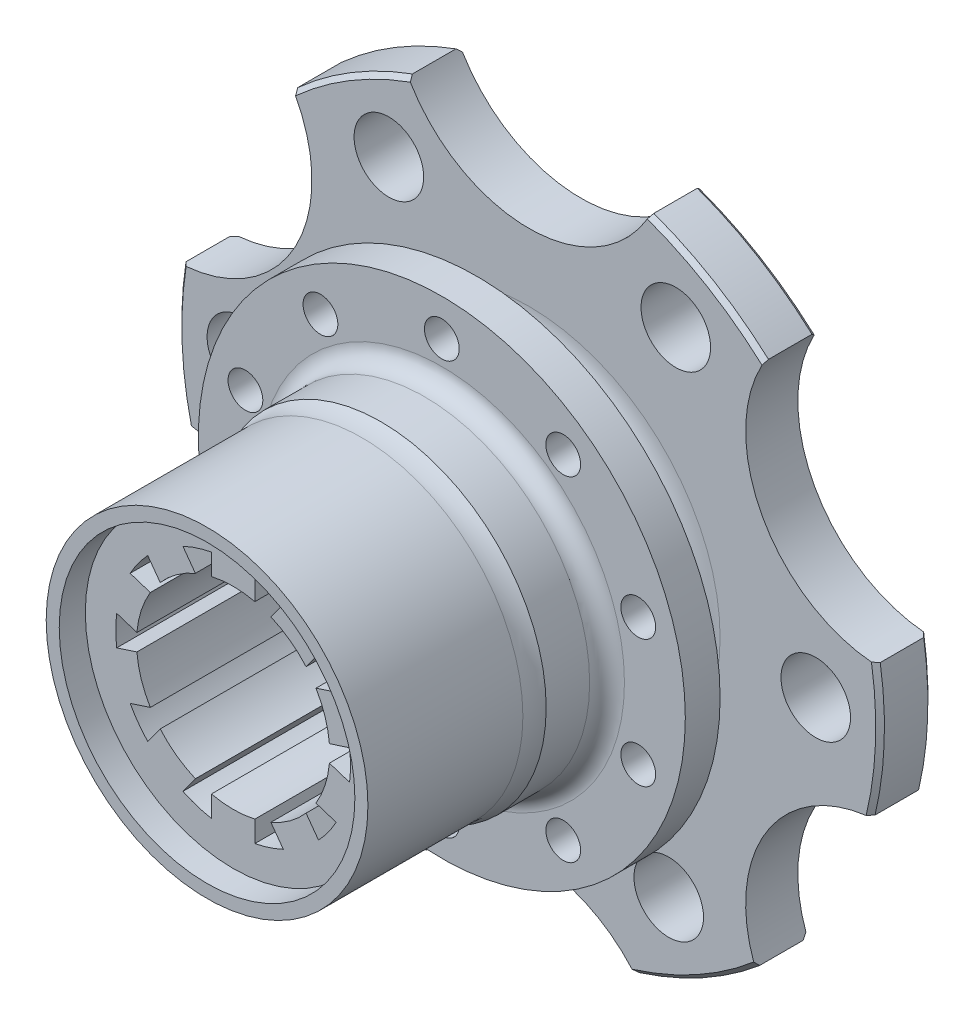
from build123d import *

# Parameters (mm, degrees)
SKETCH1_R               = 40.4
BOSS_EXTRUDE1_DEPTH     = 3
CUT_EXTRUDE1_DEPTH      = 58.2129356
CIRPATTERN1_COUNT       = 6
SKETCH3_R               = 4
CUT_EXTRUDE2_DEPTH      = 57.132541063
SKETCH4_R               = 17
BOSS_EXTRUDE2_DEPTH     = 40
CUT_EXTRUDE3_DEPTH      = 69.664853937
CUT_EXTRUDE3_DEPTH_BACK = 69.664853937
SKETCH5_R               = 11.1125
FILLET1_R               = 5
SKETCH6_R               = 28
SKETCH6_R_2             = 17
BOSS_EXTRUDE3_DEPTH     = 4
SKETCH7_R               = 19
SKETCH7_R_2             = 17
BOSS_EXTRUDE4_DEPTH     = 7
SKETCH8_R               = 18.5
SKETCH8_R_2             = 17
EXTRUDE_THIN1_DEPTH     = 20
CUT_EXTRUDE4_REACH      = 63.999
SKETCH9_R               = 2
FILLET2_R               = 5
FILLET3_R               = 2
CHAMFER1_SIZE           = 0.5
CHAMFER2_SIZE           = 4
CUT_EXTRUDE6_DEPTH      = 69.664854111
CUT_EXTRUDE6_DEPTH_BACK = 69.664854111


with BuildPart() as part:
    # Sketch1 → Boss-Extrude1 (new, symmetric)
    with BuildSketch(Plane.XY):
        Circle(SKETCH1_R)
    extrude(amount=BOSS_EXTRUDE1_DEPTH, both=True)

    # Sketch2 → Cut-Extrude1 (cut, symmetric)
    with BuildSketch(Plane.XY):
        with BuildLine():
            ThreePointArc((0, 61.461961419), (-13.591228185, 53.77241449), (-14, 38.162048666))
            ThreePointArc((-14, 38.162048666), (-8.166433781, 32.014752525), (0, 29.75))
            Line((0, 29.75), (0, 61.461961419))
        make_face()
        with BuildLine():
            ThreePointArc((15.85598071, 45.60598071), (11.211871482, 56.817852192), (0, 61.461961419))
            Line((0, 61.461961419), (0, 29.75))
            ThreePointArc((0, 29.75), (8.166433781, 32.014752525), (14, 38.162048666))
            ThreePointArc((14, 38.162048666), (15.384990318, 41.7700718), (15.85598071, 45.60598071))
        make_face()
        with BuildLine():
            Line((30.296043793, 68.810449508), (0, 68.810449508))
            Line((0, 68.810449508), (0, 61.461961419))
            ThreePointArc((0, 61.461961419), (11.211871482, 56.817852192), (15.85598071, 45.60598071))
            ThreePointArc((15.85598071, 45.60598071), (15.384990318, 41.7700718), (14, 38.162048666))
            Line((14, 38.162048666), (30.296043793, 68.810449508))
        make_face()
        with BuildLine():
            Line((0, 68.810449508), (-30.296043793, 68.810449508))
            Line((-30.296043793, 68.810449508), (-14, 38.162048666))
            ThreePointArc((-14, 38.162048666), (-13.591228185, 53.77241449), (0, 61.461961419))
            Line((0, 61.461961419), (0, 68.810449508))
        make_face()
    cut_extrude1 = extrude(amount=CUT_EXTRUDE1_DEPTH, both=True, mode=Mode.SUBTRACT)

    # CirPattern1: Cut-Extrude1 ×6 about axis
    cirpattern1_axis = Axis((0, -1.498566429, 0), (0, 0, 1))
    for i in range(1, CIRPATTERN1_COUNT):
        add(cut_extrude1.rotate(cirpattern1_axis, i * 360 / CIRPATTERN1_COUNT), mode=Mode.SUBTRACT)

    # Sketch3 → Cut-Extrude2 (cut, through all)
    with BuildSketch(Plane.XY.offset(3)):
        with Locations((16.90518394, 28.341043664)):
            Circle(SKETCH3_R)
        with Locations((32.996655753, -0.469796916)):
            Circle(SKETCH3_R)
        with Locations((16.091471813, -28.81084058)):
            Circle(SKETCH3_R)
        with Locations((-16.90518394, -28.341043664)):
            Circle(SKETCH3_R)
        with Locations((-32.996655753, 0.469796916)):
            Circle(SKETCH3_R)
        with Locations((-16.091471813, 28.81084058)):
            Circle(SKETCH3_R)
    extrude(amount=-CUT_EXTRUDE2_DEPTH, mode=Mode.SUBTRACT)

    # Sketch4 → Boss-Extrude2 (add)
    with BuildSketch(Plane(origin=(0, 0, -3), x_dir=(-1, 0, 0), z_dir=(0, 0, -1))):
        Circle(SKETCH4_R)
    extrude(amount=-BOSS_EXTRUDE2_DEPTH)

    # Sketch5 → Cut-Extrude3 (cut, two sides: drawn at the far end of the back side and taken through both)
    with BuildSketch(Plane.XY.offset(37).offset(-CUT_EXTRUDE3_DEPTH_BACK)):
        Circle(SKETCH5_R)
    extrude(amount=CUT_EXTRUDE3_DEPTH + CUT_EXTRUDE3_DEPTH_BACK, mode=Mode.SUBTRACT)

    # Fillet1
    fillet1_edges = [part.edges().sort_by_distance(p)[0] for p in [
        (17, 0, 3),
    ]]
    fillet(fillet1_edges, radius=FILLET1_R)

    # Sketch6 → Boss-Extrude3 (add)
    with BuildSketch(Plane.XY.offset(9)):
        Circle(SKETCH6_R)
        Circle(SKETCH6_R_2, mode=Mode.SUBTRACT)
    extrude(amount=BOSS_EXTRUDE3_DEPTH)

    # Sketch7 → Boss-Extrude4 (add)
    with BuildSketch(Plane.XY.offset(13)):
        Circle(SKETCH7_R)
        Circle(SKETCH7_R_2, mode=Mode.SUBTRACT)
    extrude(amount=BOSS_EXTRUDE4_DEPTH)

    # Sketch8 → Extrude-Thin1 (add)
    with BuildSketch(Plane.XY.offset(20)):
        Circle(SKETCH8_R)
        Circle(SKETCH8_R_2, mode=Mode.SUBTRACT)
    extrude(amount=EXTRUDE_THIN1_DEPTH)

    # Sketch9 → Cut-Extrude4 (cut, up to next)
    with BuildSketch(Plane.XY.offset(13), mode=Mode.PRIVATE) as cut_extrude4_sk1:
        with Locations((0, 23.75)):
            Circle(SKETCH9_R)
    cut_extrude4_tool1 = extrude(cut_extrude4_sk1.sketch, amount=-CUT_EXTRUDE4_REACH, mode=Mode.PRIVATE) & part.part
    # Sketch9 → Cut-Extrude4 (cut, up to next)
    with BuildSketch(Plane.XY.offset(13), mode=Mode.PRIVATE) as cut_extrude4_sk2:
        with Locations((13.959899742, 19.214153616)):
            Circle(SKETCH9_R)
    cut_extrude4_tool2 = extrude(cut_extrude4_sk2.sketch, amount=-CUT_EXTRUDE4_REACH, mode=Mode.PRIVATE) & part.part
    # Sketch9 → Cut-Extrude4 (cut, up to next)
    with BuildSketch(Plane.XY.offset(13), mode=Mode.PRIVATE) as cut_extrude4_sk3:
        with Locations((22.587592262, 7.339153616)):
            Circle(SKETCH9_R)
    cut_extrude4_tool3 = extrude(cut_extrude4_sk3.sketch, amount=-CUT_EXTRUDE4_REACH, mode=Mode.PRIVATE) & part.part
    # Sketch9 → Cut-Extrude4 (cut, up to next)
    with BuildSketch(Plane.XY.offset(13), mode=Mode.PRIVATE) as cut_extrude4_sk4:
        with Locations((22.587592262, -7.339153616)):
            Circle(SKETCH9_R)
    cut_extrude4_tool4 = extrude(cut_extrude4_sk4.sketch, amount=-CUT_EXTRUDE4_REACH, mode=Mode.PRIVATE) & part.part
    # Sketch9 → Cut-Extrude4 (cut, up to next)
    with BuildSketch(Plane.XY.offset(13), mode=Mode.PRIVATE) as cut_extrude4_sk5:
        with Locations((13.959899742, -19.214153616)):
            Circle(SKETCH9_R)
    cut_extrude4_tool5 = extrude(cut_extrude4_sk5.sketch, amount=-CUT_EXTRUDE4_REACH, mode=Mode.PRIVATE) & part.part
    # Sketch9 → Cut-Extrude4 (cut, up to next)
    with BuildSketch(Plane.XY.offset(13), mode=Mode.PRIVATE) as cut_extrude4_sk6:
        with Locations((0, -23.75)):
            Circle(SKETCH9_R)
    cut_extrude4_tool6 = extrude(cut_extrude4_sk6.sketch, amount=-CUT_EXTRUDE4_REACH, mode=Mode.PRIVATE) & part.part
    # Sketch9 → Cut-Extrude4 (cut, up to next)
    with BuildSketch(Plane.XY.offset(13), mode=Mode.PRIVATE) as cut_extrude4_sk7:
        with Locations((-13.959899742, -19.214153616)):
            Circle(SKETCH9_R)
    cut_extrude4_tool7 = extrude(cut_extrude4_sk7.sketch, amount=-CUT_EXTRUDE4_REACH, mode=Mode.PRIVATE) & part.part
    # Sketch9 → Cut-Extrude4 (cut, up to next)
    with BuildSketch(Plane.XY.offset(13), mode=Mode.PRIVATE) as cut_extrude4_sk8:
        with Locations((-22.587592262, -7.339153616)):
            Circle(SKETCH9_R)
    cut_extrude4_tool8 = extrude(cut_extrude4_sk8.sketch, amount=-CUT_EXTRUDE4_REACH, mode=Mode.PRIVATE) & part.part
    # Sketch9 → Cut-Extrude4 (cut, up to next)
    with BuildSketch(Plane.XY.offset(13), mode=Mode.PRIVATE) as cut_extrude4_sk9:
        with Locations((-22.587592262, 7.339153616)):
            Circle(SKETCH9_R)
    cut_extrude4_tool9 = extrude(cut_extrude4_sk9.sketch, amount=-CUT_EXTRUDE4_REACH, mode=Mode.PRIVATE) & part.part
    # Sketch9 → Cut-Extrude4 (cut, up to next)
    with BuildSketch(Plane.XY.offset(13), mode=Mode.PRIVATE) as cut_extrude4_sk10:
        with Locations((-13.959899742, 19.214153616)):
            Circle(SKETCH9_R)
    cut_extrude4_tool10 = extrude(cut_extrude4_sk10.sketch, amount=-CUT_EXTRUDE4_REACH, mode=Mode.PRIVATE) & part.part
    add(cut_extrude4_tool1.solids().sort_by_distance((0, 23.75, 13))[0], mode=Mode.SUBTRACT)
    add(cut_extrude4_tool2.solids().sort_by_distance((13.9599, 19.214154, 13))[0], mode=Mode.SUBTRACT)
    add(cut_extrude4_tool3.solids().sort_by_distance((22.587592, 7.339154, 13))[0], mode=Mode.SUBTRACT)
    add(cut_extrude4_tool4.solids().sort_by_distance((22.587592, -7.339154, 13))[0], mode=Mode.SUBTRACT)
    add(cut_extrude4_tool5.solids().sort_by_distance((13.9599, -19.214154, 13))[0], mode=Mode.SUBTRACT)
    add(cut_extrude4_tool6.solids().sort_by_distance((0, -23.75, 13))[0], mode=Mode.SUBTRACT)
    add(cut_extrude4_tool7.solids().sort_by_distance((-13.9599, -19.214154, 13))[0], mode=Mode.SUBTRACT)
    add(cut_extrude4_tool8.solids().sort_by_distance((-22.587592, -7.339154, 13))[0], mode=Mode.SUBTRACT)
    add(cut_extrude4_tool9.solids().sort_by_distance((-22.587592, 7.339154, 13))[0], mode=Mode.SUBTRACT)
    add(cut_extrude4_tool10.solids().sort_by_distance((-13.9599, 19.214154, 13))[0], mode=Mode.SUBTRACT)

    # Fillet2
    # the kernel refuses this fillet: 5 mm, written as the material it adds along each edge
    with BuildSketch(Plane(origin=(0, 0, 20), x_dir=(1, 0, 0), z_dir=(0, -1, 0))) as fillet2_piece_1:
        with BuildLine():
            CenterArc((23.5, 2.179449472), FILLET2_R, 180, 25.841932763)
            Line((18.5, 2.179449472), (18.4, 2.179449472))
            Line((18.4, 2.179449472), (18.4, 0))
            Line((18.4, 0), (18.5, -0.1))
            ThreePointArc((18.5, -0.1), (18.75, -0.1), (18.91, -0.043588989))
            Line((18.91, -0.043588989), (19, 0))
        make_face()
    revolve(axis=Axis((0, 0, 20), (0, 0, 1)))

    # Fillet3
    fillet3_edges = [part.edges().sort_by_distance(p)[0] for p in [
        (-19, 0, 13),
    ]]
    fillet(fillet3_edges, radius=FILLET3_R)

    # Chamfer1
    chamfer1_edges = [part.edges().sort_by_distance(p)[0] for p in [
        (-40.370279201, -1.549373164, -3),
        (-19.512965356, -35.375191632, -3),
        (19.512965356, -35.375191632, -3),
        (40.370279201, -1.549373164, -3),
        (20.85615574, 34.600300111, -3),
        (-40.370279201, -1.549373164, 3),
        (-19.512965356, -35.375191632, 3),
        (19.512965356, -35.375191632, 3),
        (40.370279201, -1.549373164, 3),
        (20.85615574, 34.600300111, 3),
        (-20.85615574, 34.600300111, -3),
        (-20.85615574, 34.600300111, 3),
    ]]
    chamfer(chamfer1_edges, length=CHAMFER1_SIZE)

    # Chamfer2
    chamfer2_edges = [part.edges().sort_by_distance(p)[0] for p in [
        (-11.1125, 0, -3),
    ]]
    chamfer(chamfer2_edges, length=CHAMFER2_SIZE)

    # Sketch10 → Cut-Extrude6 (cut, two sides: drawn at the far end of the back side and taken through both)
    with BuildSketch(Plane.XY.offset(37).offset(-CUT_EXTRUDE6_DEPTH_BACK)):
        with BuildLine():
            Line((-2.5, 10.827633917), (-2.5, 13.266499161))
            ThreePointArc((-2.5, 13.266499161), (-4.171729424, 12.83926297), (-5.775310071, 12.202286408))
            Line((-5.775310071, 12.202286408), (-4.341781048, 10.229202979))
            ThreePointArc((-4.341781048, 10.229202979), (-3.43395135, 10.568615537), (-2.5, 10.827633917))
        make_face()
        with BuildLine():
            ThreePointArc((5.775310071, 12.202286408), (4.171729424, 12.83926297), (2.5, 13.266499161))
            Line((2.5, 13.266499161), (2.5, 10.827633917))
            ThreePointArc((2.5, 10.827633917), (3.43395135, 10.568615537), (4.341781048, 10.229202979))
            Line((4.341781048, 10.229202979), (5.775310071, 12.202286408))
        make_face()
        with BuildLine():
            Line((-8.38686602, 7.290276717), (-9.820395043, 9.263360147))
            ThreePointArc((-9.820395043, 9.263360147), (-10.921729424, 7.935100906), (-11.84464799, 6.477214987))
            Line((-11.84464799, 6.477214987), (-9.525149307, 5.72356418))
            ThreePointArc((-9.525149307, 5.72356418), (-8.99020135, 6.531763616), (-8.38686602, 7.290276717))
        make_face()
        with BuildLine():
            Line((-11.070234279, 0.968281599), (-13.389732962, 1.721932406))
            ThreePointArc((-13.389732962, 1.721932406), (-13.5, 0), (-13.389732962, -1.721932406))
            Line((-13.389732962, -1.721932406), (-11.070234279, -0.968281599))
            ThreePointArc((-11.070234279, -0.968281599), (-11.1125, 0), (-11.070234279, 0.968281599))
        make_face()
        with BuildLine():
            Line((-9.525149307, -5.72356418), (-11.84464799, -6.477214987))
            ThreePointArc((-11.84464799, -6.477214987), (-10.921729424, -7.935100906), (-9.820395043, -9.263360147))
            Line((-9.820395043, -9.263360147), (-8.38686602, -7.290276717))
            ThreePointArc((-8.38686602, -7.290276717), (-8.99020135, -6.531763616), (-9.525149307, -5.72356418))
        make_face()
        with BuildLine():
            Line((-4.341781048, -10.229202979), (-5.775310071, -12.202286408))
            ThreePointArc((-5.775310071, -12.202286408), (-4.171729424, -12.83926297), (-2.5, -13.266499161))
            Line((-2.5, -13.266499161), (-2.5, -10.827633917))
            ThreePointArc((-2.5, -10.827633917), (-3.43395135, -10.568615537), (-4.341781048, -10.229202979))
        make_face()
        with BuildLine():
            ThreePointArc((2.5, -13.266499161), (4.171729424, -12.83926297), (5.775310071, -12.202286408))
            Line((5.775310071, -12.202286408), (4.341781048, -10.229202979))
            ThreePointArc((4.341781048, -10.229202979), (3.43395135, -10.568615537), (2.5, -10.827633917))
            Line((2.5, -10.827633917), (2.5, -13.266499161))
        make_face()
        with BuildLine():
            ThreePointArc((9.820395043, -9.263360147), (10.921729424, -7.935100906), (11.84464799, -6.477214987))
            Line((11.84464799, -6.477214987), (9.525149307, -5.72356418))
            ThreePointArc((9.525149307, -5.72356418), (8.99020135, -6.531763616), (8.38686602, -7.290276717))
            Line((8.38686602, -7.290276717), (9.820395043, -9.263360147))
        make_face()
        with BuildLine():
            ThreePointArc((13.5, 0), (13.472405037, 0.862729684), (13.389732962, 1.721932406))
            Line((13.389732962, 1.721932406), (11.070234279, 0.968281599))
            ThreePointArc((11.070234279, 0.968281599), (11.101928541, 0.484601807), (11.1125, 0))
            ThreePointArc((11.1125, 0), (11.101928541, -0.484601807), (11.070234279, -0.968281599))
            Line((11.070234279, -0.968281599), (13.389732962, -1.721932406))
            ThreePointArc((13.389732962, -1.721932406), (13.472405037, -0.862729684), (13.5, 0))
        make_face()
        with BuildLine():
            ThreePointArc((11.84464799, 6.477214987), (10.921729424, 7.935100906), (9.820395043, 9.263360147))
            Line((9.820395043, 9.263360147), (8.38686602, 7.290276717))
            ThreePointArc((8.38686602, 7.290276717), (8.99020135, 6.531763616), (9.525149307, 5.72356418))
            Line((9.525149307, 5.72356418), (11.84464799, 6.477214987))
        make_face()
    extrude(amount=CUT_EXTRUDE6_DEPTH + CUT_EXTRUDE6_DEPTH_BACK, mode=Mode.SUBTRACT)


solid = part.part
